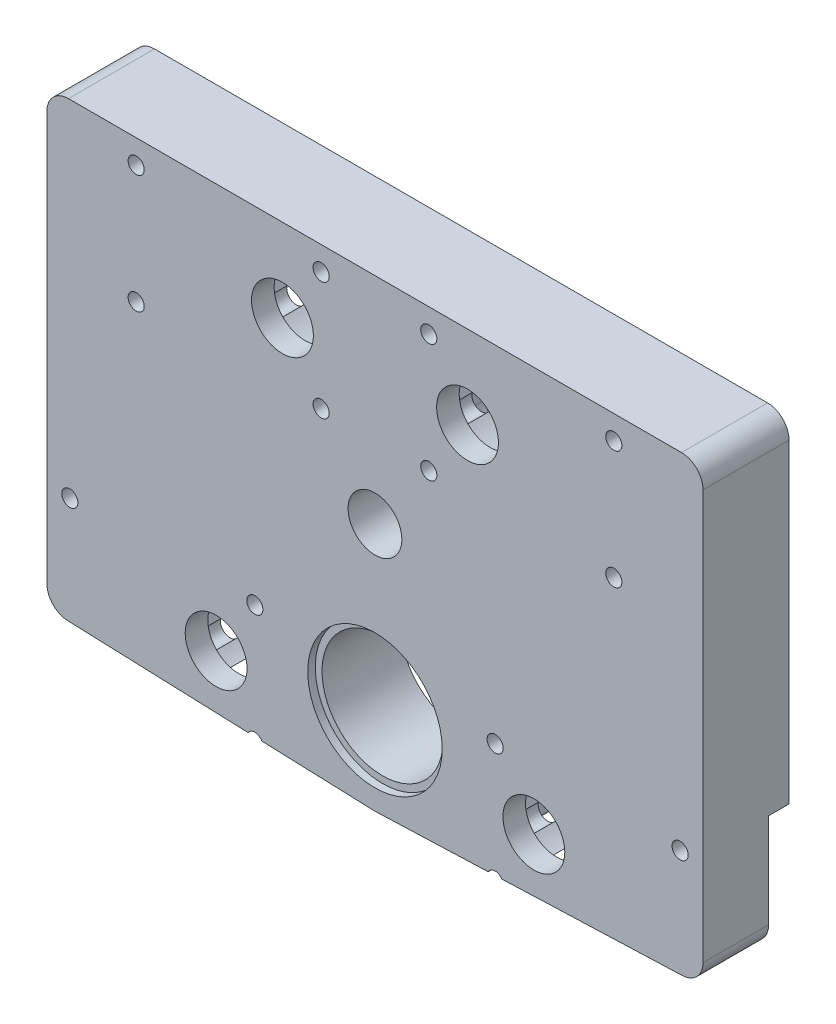
from build123d import *

# Parameters (mm, degrees)
SKETCH1_R             = 7.3025
SKETCH1_R_2           = 6.35
SKETCH1_R_3           = 14.2875
BOSS_EXTRUDE2_DEPTH   = 20.32
CAVITY1_OUTLINE_R     = 7.3025
CAVITY1_OUTLINE_R_2   = 1.143
CAVITY1_OUTLINE_R_3   = 4.445
CAVITY1_DEPTH         = 14.986
CAVITY1_2_OUTLINE_R   = 1.143
CAVITY1_2_OUTLINE_R_2 = 4.445
CAVITY1_2_DEPTH       = 4.826
CAVITY1_START         = 14.986
CAVITY1_3_OUTLINE_R   = 1.143
CAVITY1_3_OUTLINE_R_2 = 4.445
CAVITY1_3_DEPTH       = 3.048
CAVITY1_START_2       = 4.826
CAVITY1_4_DEPTH       = 1.778
CAVITY1_START_3       = 17.018
CAVITY1_5_OUTLINE_R   = 1.905
CAVITY1_5_DEPTH       = 3.302
CAVITY1_6_OUTLINE_R   = 2.286
CAVITY1_6_DEPTH       = 1.27
CAVITY1_START_4       = 18.034
CAVITY1_7_DEPTH       = 0.254
FILLET1_R             = 5.08
SKETCH3_R             = 15.875
CUT_EXTRUDE1_DEPTH    = 1.778


# Read off the part's stored shape, not the designer's step: Cavity1
with BuildPart() as part:
    # Sketch1 → Boss-Extrude2 (new body)
    with BuildSketch(Plane.XY):
        with BuildLine():
            Line((-77.47, 50.8), (77.47, 50.8))
            Line((77.47, 50.8), (77.47, -55.88))
            Line((77.47, -55.88), (0.764469994, -58.7233361))
            ThreePointArc((0.764469994, -58.7233361), (0, -58.7375), (-0.764469994, -58.7233361))
            Line((-0.764469994, -58.7233361), (-77.47, -55.88))
            Line((-77.47, -55.88), (-77.47, 50.8))
        make_face()
        with Locations((-21.853262225, 31.209692887)):
            Circle(SKETCH1_R, mode=Mode.SUBTRACT)
        Circle(SKETCH1_R_2, mode=Mode.SUBTRACT)
        with Locations((-37.52117539, -44.715995569)):
            Circle(SKETCH1_R, mode=Mode.SUBTRACT)
        with Locations((21.853262225, 31.209692887)):
            Circle(SKETCH1_R, mode=Mode.SUBTRACT)
        with Locations((37.52117539, -44.715995569)):
            Circle(SKETCH1_R, mode=Mode.SUBTRACT)
        with Locations((0, -38.1)):
            Circle(SKETCH1_R_3, mode=Mode.SUBTRACT)
    extrude(amount=BOSS_EXTRUDE2_DEPTH)

    # Cavity1 outline → Cavity1 (cut)
    # profile 1 of 22: a face of its own
    with BuildSketch(Plane.XY):
        with BuildLine():
            ThreePointArc((9.143073707, 37.873198634), (7.502262225, 31.209692888), (9.143073707, 24.546187141))
            ThreePointArc((9.143073707, 24.546187141), (7.814157011, 20.972845335), (11.622694721, 21.145564035))
            ThreePointArc((11.622694721, 21.145564035), (21.853262225, 16.858692887), (32.083829729, 21.145564035))
            ThreePointArc((32.083829729, 21.145564035), (35.892367439, 20.972845335), (34.563450743, 24.54618714))
            ThreePointArc((34.563450743, 24.54618714), (36.204262225, 31.209692887), (34.563450743, 37.873198634))
            ThreePointArc((34.563450743, 37.873198634), (35.892367439, 41.446540439), (32.083829729, 41.27382174))
            ThreePointArc((32.083829729, 41.27382174), (21.853262225, 45.560692887), (11.622694721, 41.27382174))
            ThreePointArc((11.622694721, 41.27382174), (7.814157011, 41.446540439), (9.143073707, 37.873198634))
        make_face()
        with Locations((21.853262225, 31.209692887)):
            Circle(CAVITY1_OUTLINE_R, mode=Mode.SUBTRACT)
    # profile 2 of 22: a face of its own
    with BuildSketch(Plane.XY):
        with Locations((12.709262225, 45.179692887)):
            Circle(CAVITY1_OUTLINE_R_2)
    # profile 3 of 22: a face of its own
    with BuildSketch(Plane.XY):
        with BuildLine():
            ThreePointArc((-11.622694721, 41.27382174), (-21.853262225, 45.560692887), (-32.083829729, 41.27382174))
            ThreePointArc((-32.083829729, 41.27382174), (-35.892367439, 41.446540439), (-34.563450743, 37.873198634))
            ThreePointArc((-34.563450743, 37.873198634), (-36.204262225, 31.209692887), (-34.563450743, 24.546187141))
            ThreePointArc((-34.563450743, 24.546187141), (-35.892367439, 20.972845335), (-32.083829729, 21.145564035))
            ThreePointArc((-32.083829729, 21.145564035), (-21.853262225, 16.858692887), (-11.622694721, 21.145564035))
            ThreePointArc((-11.622694721, 21.145564035), (-7.814157011, 20.972845335), (-9.143073707, 24.54618714))
            ThreePointArc((-9.143073707, 24.54618714), (-7.502262225, 31.209692887), (-9.143073707, 37.873198634))
            ThreePointArc((-9.143073707, 37.873198634), (-7.814157011, 41.446540439), (-11.622694721, 41.27382174))
        make_face()
        with Locations((-21.853262225, 31.209692887)):
            Circle(CAVITY1_OUTLINE_R, mode=Mode.SUBTRACT)
    # profile 4 of 22: a face of its own
    with BuildSketch(Plane.XY):
        with Locations((56.397262225, 45.179692887)):
            Circle(CAVITY1_OUTLINE_R_2)
    # profile 5 of 22: a face of its own
    with BuildSketch(Plane.XY):
        with Locations((-12.709262225, 45.179692887)):
            Circle(CAVITY1_OUTLINE_R_2)
    # profile 6 of 22: a face of its own
    with BuildSketch(Plane.XY):
        with Locations((47.253262225, 31.209692887)):
            Circle(CAVITY1_OUTLINE_R_3)
    # profile 7 of 22: a face of its own
    with BuildSketch(Plane.XY):
        with Locations((12.709262225, 17.239692887)):
            Circle(CAVITY1_OUTLINE_R_2)
    # profile 8 of 22: a face of its own
    with BuildSketch(Plane.XY):
        with Locations((-56.397262225, 45.179692887)):
            Circle(CAVITY1_OUTLINE_R_2)
    # profile 9 of 22: a face of its own
    with BuildSketch(Plane.XY):
        with Locations((-12.709262225, 17.239692887)):
            Circle(CAVITY1_OUTLINE_R_2)
    # profile 10 of 22: a face of its own
    with BuildSketch(Plane.XY):
        with Locations((-47.253262225, 31.209692887)):
            Circle(CAVITY1_OUTLINE_R_3)
    # profile 11 of 22: a face of its own
    with BuildSketch(Plane.XY):
        with Locations((56.397262225, 17.239692887)):
            Circle(CAVITY1_OUTLINE_R_2)
    # profile 12 of 22: a face of its own
    with BuildSketch(Plane.XY):
        with BuildLine():
            ThreePointArc((44.787432071, -57.091484038), (46.345590949, -56.033278416), (47.751742893, -54.780124421))
            ThreePointArc((47.751742893, -54.780124421), (51.560280604, -54.952843121), (50.231363908, -51.379501316))
            ThreePointArc((50.231363908, -51.379501316), (51.87217539, -44.715995569), (50.231363908, -38.052489822))
            ThreePointArc((50.231363908, -38.052489822), (51.560280604, -34.479148017), (47.751742893, -34.651866717))
            ThreePointArc((47.751742893, -34.651866717), (37.52117539, -30.364995569), (27.290607886, -34.651866717))
            ThreePointArc((27.290607886, -34.651866717), (23.482070176, -34.479148017), (24.810986872, -38.052489822))
            ThreePointArc((24.810986872, -38.052489822), (23.17017539, -44.715995569), (24.810986872, -51.379501316))
            ThreePointArc((24.810986872, -51.379501316), (23.482070176, -54.952843121), (27.290607886, -54.780124421))
            ThreePointArc((27.290607886, -54.780124421), (29.122039602, -56.352391877), (31.191075024, -57.595476551))
            Line((31.191075024, -57.595476551), (44.787432071, -57.091484038))
        make_face()
        with Locations((37.52117539, -44.715995569)):
            Circle(CAVITY1_OUTLINE_R, mode=Mode.SUBTRACT)
    # profile 13 of 22: a face of its own
    with BuildSketch(Plane.XY):
        with Locations((28.37717539, -30.745995569)):
            Circle(CAVITY1_OUTLINE_R_2)
    # profile 14 of 22: a face of its own
    with BuildSketch(Plane.XY):
        with BuildLine():
            ThreePointArc((-50.231363908, -51.379501316), (-51.560280604, -54.952843121), (-47.751742893, -54.780124421))
            ThreePointArc((-47.751742893, -54.780124421), (-46.345590949, -56.033278416), (-44.787432071, -57.091484038))
            Line((-44.787432071, -57.091484038), (-31.191075024, -57.595476551))
            ThreePointArc((-31.191075024, -57.595476551), (-29.122039602, -56.352391877), (-27.290607886, -54.780124421))
            ThreePointArc((-27.290607886, -54.780124421), (-23.482070176, -54.952843121), (-24.810986872, -51.379501316))
            ThreePointArc((-24.810986872, -51.379501316), (-23.17017539, -44.715995569), (-24.810986872, -38.052489822))
            ThreePointArc((-24.810986872, -38.052489822), (-23.482070176, -34.479148017), (-27.290607886, -34.651866717))
            ThreePointArc((-27.290607886, -34.651866717), (-37.52117539, -30.364995569), (-47.751742893, -34.651866717))
            ThreePointArc((-47.751742893, -34.651866717), (-51.560280604, -34.479148017), (-50.231363908, -38.052489822))
            ThreePointArc((-50.231363908, -38.052489822), (-51.87217539, -44.715995569), (-50.231363908, -51.379501316))
        make_face()
        with Locations((-37.52117539, -44.715995569)):
            Circle(CAVITY1_OUTLINE_R, mode=Mode.SUBTRACT)
    # profile 15 of 22: a face of its own
    with BuildSketch(Plane.XY):
        with Locations((-56.397262225, 17.239692887)):
            Circle(CAVITY1_OUTLINE_R_2)
    # profile 16 of 22: a face of its own
    with BuildSketch(Plane.XY):
        with Locations((72.06517539, -30.745995569)):
            Circle(CAVITY1_OUTLINE_R_2)
    # profile 17 of 22: a face of its own
    with BuildSketch(Plane.XY):
        with Locations((-28.37717539, -30.745995569)):
            Circle(CAVITY1_OUTLINE_R_2)
    # profile 18 of 22: a face of its own
    with BuildSketch(Plane.XY):
        with Locations((-72.06517539, -30.745995569)):
            Circle(CAVITY1_OUTLINE_R_2)
    # profile 19 of 22: a face of its own
    with BuildSketch(Plane.XY):
        with Locations((62.92117539, -44.715995569)):
            Circle(CAVITY1_OUTLINE_R_3)
    # profile 20 of 22: a face of its own
    with BuildSketch(Plane.XY):
        with BuildLine():
            ThreePointArc((-27.762128908, -57.722581419), (-28.334835513, -57.543780031), (-28.919207924, -57.67969058))
            Line((-28.919207924, -57.67969058), (-27.762128908, -57.722581419))
        make_face()
    # profile 21 of 22: a face of its own
    with BuildSketch(Plane.XY):
        with BuildLine():
            Line((27.762128908, -57.722581419), (28.919207924, -57.67969058))
            ThreePointArc((28.919207924, -57.67969058), (28.334835513, -57.543780031), (27.762128908, -57.722581419))
        make_face()
    # profile 22 of 22: a face of its own
    with BuildSketch(Plane.XY):
        with Locations((-62.92117539, -44.715995569)):
            Circle(CAVITY1_OUTLINE_R_3)
    extrude(amount=CAVITY1_DEPTH, mode=Mode.SUBTRACT)

    # Cavity1 2 outline → Cavity1 2 (cut)
    # profile 1 of 4: a face of its own
    with BuildSketch(Plane.XY):
        with BuildLine():
            ThreePointArc((9.280262225, 47.846692887), (6.765790511, 46.805164601), (5.724262225, 44.290692887))
            Line((5.724262225, 44.290692887), (5.724262225, 18.128692887))
            ThreePointArc((5.724262225, 18.128692887), (6.765790512, 15.614221174), (9.280262225, 14.572692887))
            Line((9.280262225, 14.572692887), (59.826262225, 14.572692887))
            ThreePointArc((59.826262225, 14.572692887), (62.340733939, 15.614221173), (63.382262225, 18.128692887))
            Line((63.382262225, 18.128692887), (63.382262225, 44.290692887))
            ThreePointArc((63.382262225, 44.290692887), (62.340733939, 46.805164601), (59.826262225, 47.846692887))
            Line((59.826262225, 47.846692887), (9.280262225, 47.846692887))
        make_face()
        with BuildLine():
            ThreePointArc((11.622694721, 41.27382174), (21.853262225, 45.560692887), (32.083829729, 41.27382174))
            ThreePointArc((32.083829729, 41.27382174), (35.892367439, 41.446540439), (34.563450743, 37.873198634))
            ThreePointArc((34.563450743, 37.873198634), (36.204262225, 31.209692887), (34.563450743, 24.546187141))
            ThreePointArc((34.563450743, 24.546187141), (35.892367439, 20.972845335), (32.083829729, 21.145564035))
            ThreePointArc((32.083829729, 21.145564035), (21.853262225, 16.858692887), (11.622694721, 21.145564035))
            ThreePointArc((11.622694721, 21.145564035), (7.814157011, 20.972845335), (9.143073707, 24.54618714))
            ThreePointArc((9.143073707, 24.54618714), (7.502262225, 31.209692888), (9.143073707, 37.873198634))
            ThreePointArc((9.143073707, 37.873198634), (7.814157011, 41.446540439), (11.622694721, 41.27382174))
        make_face(mode=Mode.SUBTRACT)
        with Locations((12.709262225, 45.179692887)):
            Circle(CAVITY1_2_OUTLINE_R, mode=Mode.SUBTRACT)
        with Locations((56.397262225, 45.179692887)):
            Circle(CAVITY1_2_OUTLINE_R, mode=Mode.SUBTRACT)
        with Locations((47.253262225, 31.209692887)):
            Circle(CAVITY1_2_OUTLINE_R_2, mode=Mode.SUBTRACT)
        with Locations((12.709262225, 17.239692887)):
            Circle(CAVITY1_2_OUTLINE_R, mode=Mode.SUBTRACT)
        with Locations((56.397262225, 17.239692887)):
            Circle(CAVITY1_2_OUTLINE_R, mode=Mode.SUBTRACT)
    # profile 2 of 4: a face of its own
    with BuildSketch(Plane.XY):
        with BuildLine():
            Line((-9.280262225, 47.846692887), (-59.826262225, 47.846692887))
            ThreePointArc((-59.826262225, 47.846692887), (-62.340733939, 46.805164601), (-63.382262225, 44.290692887))
            Line((-63.382262225, 44.290692887), (-63.382262225, 18.128692887))
            ThreePointArc((-63.382262225, 18.128692887), (-62.340733939, 15.614221173), (-59.826262225, 14.572692887))
            Line((-59.826262225, 14.572692887), (-9.280262225, 14.572692887))
            ThreePointArc((-9.280262225, 14.572692887), (-6.765790512, 15.614221174), (-5.724262225, 18.128692887))
            Line((-5.724262225, 18.128692887), (-5.724262225, 44.290692887))
            ThreePointArc((-5.724262225, 44.290692887), (-6.765790511, 46.805164601), (-9.280262225, 47.846692887))
        make_face()
        with BuildLine():
            ThreePointArc((-9.143073707, 37.873198634), (-7.502262225, 31.209692887), (-9.143073707, 24.546187141))
            ThreePointArc((-9.143073707, 24.546187141), (-7.814157011, 20.972845335), (-11.622694721, 21.145564035))
            ThreePointArc((-11.622694721, 21.145564035), (-21.853262225, 16.858692887), (-32.083829729, 21.145564035))
            ThreePointArc((-32.083829729, 21.145564035), (-35.892367439, 20.972845335), (-34.563450743, 24.54618714))
            ThreePointArc((-34.563450743, 24.54618714), (-36.204262225, 31.209692887), (-34.563450743, 37.873198634))
            ThreePointArc((-34.563450743, 37.873198634), (-35.892367439, 41.446540439), (-32.083829729, 41.27382174))
            ThreePointArc((-32.083829729, 41.27382174), (-21.853262225, 45.560692887), (-11.622694721, 41.27382174))
            ThreePointArc((-11.622694721, 41.27382174), (-7.814157011, 41.446540439), (-9.143073707, 37.873198634))
        make_face(mode=Mode.SUBTRACT)
        with Locations((-12.709262225, 45.179692887)):
            Circle(CAVITY1_2_OUTLINE_R, mode=Mode.SUBTRACT)
        with Locations((-47.253262225, 31.209692887)):
            Circle(CAVITY1_2_OUTLINE_R_2, mode=Mode.SUBTRACT)
        with Locations((-56.397262225, 45.179692887)):
            Circle(CAVITY1_2_OUTLINE_R, mode=Mode.SUBTRACT)
        with Locations((-12.709262225, 17.239692887)):
            Circle(CAVITY1_2_OUTLINE_R, mode=Mode.SUBTRACT)
        with Locations((-56.397262225, 17.239692887)):
            Circle(CAVITY1_2_OUTLINE_R, mode=Mode.SUBTRACT)
    # profile 3 of 4: a face of its own
    with BuildSketch(Plane.XY):
        with BuildLine():
            ThreePointArc((27.290607886, -34.651866717), (37.52117539, -30.364995569), (47.751742893, -34.651866717))
            ThreePointArc((47.751742893, -34.651866717), (51.560280604, -34.479148017), (50.231363908, -38.052489822))
            ThreePointArc((50.231363908, -38.052489822), (51.87217539, -44.715995569), (50.231363908, -51.379501316))
            ThreePointArc((50.231363908, -51.379501316), (51.560280604, -54.952843121), (47.751742893, -54.780124421))
            ThreePointArc((47.751742893, -54.780124421), (46.345590949, -56.033278416), (44.787432071, -57.091484038))
            Line((44.787432071, -57.091484038), (77.47, -55.88))
            Line((77.47, -55.88), (77.47, -28.678434542))
            ThreePointArc((77.47, -28.678434542), (76.526552498, -28.232153594), (75.49417539, -28.078995569))
            Line((75.49417539, -28.078995569), (24.94817539, -28.078995569))
            ThreePointArc((24.94817539, -28.078995569), (22.433703676, -29.120523855), (21.39217539, -31.634995569))
            Line((21.39217539, -31.634995569), (21.39217539, -57.796995569))
            ThreePointArc((21.39217539, -57.796995569), (21.393093645, -57.877802656), (21.395847935, -57.95856801))
            Line((21.395847935, -57.95856801), (27.762128908, -57.722581419))
            ThreePointArc((27.762128908, -57.722581419), (28.334835513, -57.543780031), (28.919207924, -57.67969058))
            Line((28.919207924, -57.67969058), (31.191075024, -57.595476551))
            ThreePointArc((31.191075024, -57.595476551), (29.122039602, -56.352391877), (27.290607886, -54.780124421))
            ThreePointArc((27.290607886, -54.780124421), (23.482070176, -54.952843121), (24.810986872, -51.379501316))
            ThreePointArc((24.810986872, -51.379501316), (23.17017539, -44.715995569), (24.810986872, -38.052489822))
            ThreePointArc((24.810986872, -38.052489822), (23.482070176, -34.479148017), (27.290607886, -34.651866717))
        make_face()
        with Locations((28.37717539, -30.745995569)):
            Circle(CAVITY1_2_OUTLINE_R, mode=Mode.SUBTRACT)
        with Locations((62.92117539, -44.715995569)):
            Circle(CAVITY1_2_OUTLINE_R_2, mode=Mode.SUBTRACT)
        with Locations((72.06517539, -30.745995569)):
            Circle(CAVITY1_2_OUTLINE_R, mode=Mode.SUBTRACT)
    # profile 4 of 4: a face of its own
    with BuildSketch(Plane.XY):
        with BuildLine():
            ThreePointArc((-27.290607886, -34.651866717), (-23.482070176, -34.479148017), (-24.810986872, -38.052489822))
            ThreePointArc((-24.810986872, -38.052489822), (-23.17017539, -44.715995569), (-24.810986872, -51.379501316))
            ThreePointArc((-24.810986872, -51.379501316), (-23.482070176, -54.952843121), (-27.290607886, -54.780124421))
            ThreePointArc((-27.290607886, -54.780124421), (-29.122039602, -56.352391877), (-31.191075024, -57.595476551))
            Line((-31.191075024, -57.595476551), (-28.919207924, -57.67969058))
            ThreePointArc((-28.919207924, -57.67969058), (-28.334835513, -57.543780031), (-27.762128908, -57.722581419))
            Line((-27.762128908, -57.722581419), (-21.395847935, -57.95856801))
            ThreePointArc((-21.395847935, -57.95856801), (-21.393093645, -57.877802656), (-21.39217539, -57.796995569))
            Line((-21.39217539, -57.796995569), (-21.39217539, -31.634995569))
            ThreePointArc((-21.39217539, -31.634995569), (-22.433703676, -29.120523855), (-24.94817539, -28.078995569))
            Line((-24.94817539, -28.078995569), (-75.49417539, -28.078995569))
            ThreePointArc((-75.49417539, -28.078995569), (-76.526552498, -28.232153594), (-77.47, -28.678434542))
            Line((-77.47, -28.678434542), (-77.47, -55.88))
            Line((-77.47, -55.88), (-44.787432071, -57.091484038))
            ThreePointArc((-44.787432071, -57.091484038), (-46.345590949, -56.033278416), (-47.751742893, -54.780124421))
            ThreePointArc((-47.751742893, -54.780124421), (-51.560280604, -54.952843121), (-50.231363908, -51.379501316))
            ThreePointArc((-50.231363908, -51.379501316), (-51.87217539, -44.715995569), (-50.231363908, -38.052489822))
            ThreePointArc((-50.231363908, -38.052489822), (-51.560280604, -34.479148017), (-47.751742893, -34.651866717))
            ThreePointArc((-47.751742893, -34.651866717), (-37.52117539, -30.364995569), (-27.290607886, -34.651866717))
        make_face()
        with Locations((-28.37717539, -30.745995569)):
            Circle(CAVITY1_2_OUTLINE_R, mode=Mode.SUBTRACT)
        with Locations((-62.92117539, -44.715995569)):
            Circle(CAVITY1_2_OUTLINE_R_2, mode=Mode.SUBTRACT)
        with Locations((-72.06517539, -30.745995569)):
            Circle(CAVITY1_2_OUTLINE_R, mode=Mode.SUBTRACT)
    extrude(amount=CAVITY1_2_DEPTH, mode=Mode.SUBTRACT)

    # Cavity1 3 outline → Cavity1 3 (cut)
    with BuildSketch(Plane.XY.offset(CAVITY1_START)):
        with Locations((12.709262225, 45.179692887)):
            Circle(CAVITY1_3_OUTLINE_R)
        with Locations((56.397262225, 45.179692887)):
            Circle(CAVITY1_3_OUTLINE_R)
        with BuildLine():
            ThreePointArc((35.740077225, 27.589255047), (36.204262225, 31.209692887), (35.740077225, 34.830130728))
            ThreePointArc((35.740077225, 34.830130728), (30.743262225, 31.209692888), (35.740077225, 27.589255047))
        make_face()
        with Locations((-12.709262225, 45.179692887)):
            Circle(CAVITY1_3_OUTLINE_R)
        with Locations((47.253262225, 31.209692887)):
            Circle(CAVITY1_3_OUTLINE_R_2)
        with Locations((12.709262225, 17.239692887)):
            Circle(CAVITY1_3_OUTLINE_R)
        with Locations((-56.397262225, 45.179692887)):
            Circle(CAVITY1_3_OUTLINE_R)
        with Locations((-12.709262225, 17.239692887)):
            Circle(CAVITY1_3_OUTLINE_R)
        with BuildLine():
            ThreePointArc((-35.740077225, 27.589255047), (-30.743262225, 31.209692888), (-35.740077225, 34.830130728))
            ThreePointArc((-35.740077225, 34.830130728), (-36.204262225, 31.209692888), (-35.740077225, 27.589255047))
        make_face()
        with Locations((-47.253262225, 31.209692887)):
            Circle(CAVITY1_3_OUTLINE_R_2)
        with Locations((56.397262225, 17.239692887)):
            Circle(CAVITY1_3_OUTLINE_R)
        with Locations((28.37717539, -30.745995569)):
            Circle(CAVITY1_3_OUTLINE_R)
        with Locations((-56.397262225, 17.239692887)):
            Circle(CAVITY1_3_OUTLINE_R)
        with Locations((72.06517539, -30.745995569)):
            Circle(CAVITY1_3_OUTLINE_R)
        with Locations((-28.37717539, -30.745995569)):
            Circle(CAVITY1_3_OUTLINE_R)
        with BuildLine():
            ThreePointArc((51.40799039, -48.336433409), (51.87217539, -44.715995569), (51.40799039, -41.095557729))
            ThreePointArc((51.40799039, -41.095557729), (46.41117539, -44.715995569), (51.40799039, -48.336433409))
        make_face()
        with Locations((-72.06517539, -30.745995569)):
            Circle(CAVITY1_3_OUTLINE_R)
        with Locations((62.92117539, -44.715995569)):
            Circle(CAVITY1_3_OUTLINE_R_2)
        with BuildLine():
            ThreePointArc((-27.762128908, -57.722581419), (-28.334835513, -57.543780031), (-28.919207924, -57.67969058))
            Line((-28.919207924, -57.67969058), (-27.762128908, -57.722581419))
        make_face()
        with BuildLine():
            Line((27.762128908, -57.722581419), (28.919207924, -57.67969058))
            ThreePointArc((28.919207924, -57.67969058), (28.334835513, -57.543780031), (27.762128908, -57.722581419))
        make_face()
        with Locations((-62.92117539, -44.715995569)):
            Circle(CAVITY1_3_OUTLINE_R_2)
        with BuildLine():
            ThreePointArc((-51.40799039, -48.336433409), (-46.41117539, -44.715995569), (-51.40799039, -41.095557729))
            ThreePointArc((-51.40799039, -41.095557729), (-51.87217539, -44.715995569), (-51.40799039, -48.336433409))
        make_face()
    extrude(amount=CAVITY1_3_DEPTH, mode=Mode.SUBTRACT)

    # Cavity1 4 outline → Cavity1 4 (cut)
    with BuildSketch(Plane.XY.offset(CAVITY1_START_2)):
        with BuildLine():
            Line((46.242320893, 35.538205636), (48.151988191, 37.47945465))
            ThreePointArc((48.151988191, 37.47945465), (44.760929015, 35.790736507), (42.934910561, 32.47159386))
            Line((42.934910561, 32.47159386), (42.986204133, 32.454779325))
            ThreePointArc((42.986204133, 32.454779325), (44.196924721, 34.437203702), (46.242320893, 35.538205636))
        make_face()
        with BuildLine():
            ThreePointArc((54.920931867, 33.876927147), (52.141612003, 36.815236937), (48.151988191, 37.47945465))
            Line((48.151988191, 37.47945465), (46.242320893, 35.538205636))
            ThreePointArc((46.242320893, 35.538205636), (49.368142826, 35.119335459), (51.429331168, 32.732346225))
            Line((51.429331168, 32.732346225), (54.920931867, 33.876927147))
        make_face()
        with BuildLine():
            ThreePointArc((55.508262225, 31.209692887), (55.359691585, 32.575260127), (54.920931867, 33.876927147))
            Line((54.920931867, 33.876927147), (51.429331168, 32.732346225))
            ThreePointArc((51.429331168, 32.732346225), (51.630513157, 31.982803018), (51.698262225, 31.209692887))
            ThreePointArc((51.698262225, 31.209692887), (51.630513157, 30.436582756), (51.429331168, 29.68703955))
            Line((51.429331168, 29.68703955), (54.736042469, 28.603067184))
            Line((54.736042469, 28.603067184), (55.102132402, 28.975211443))
            ThreePointArc((55.102132402, 28.975211443), (55.405904805, 30.074148001), (55.508262225, 31.209692887))
        make_face()
        with BuildLine():
            Line((42.986204133, 32.454779325), (42.934910561, 32.47159386))
            ThreePointArc((42.934910561, 32.47159386), (42.901305735, 32.292742046), (42.872839807, 32.113000713))
            Line((42.872839807, 32.113000713), (42.908751161, 32.149505962))
            ThreePointArc((42.908751161, 32.149505962), (42.944773071, 32.302828839), (42.986204133, 32.454779325))
        make_face()
        with BuildLine():
            ThreePointArc((54.920931867, 28.542458628), (55.015530136, 28.757161008), (55.102132402, 28.975211443))
            Line((55.102132402, 28.975211443), (54.736042469, 28.603067184))
            Line((54.736042469, 28.603067184), (54.920931867, 28.542458628))
        make_face()
        with BuildLine():
            Line((42.908751161, 32.149505962), (42.872839807, 32.113000713))
            ThreePointArc((42.872839807, 32.113000713), (42.824427196, 31.662499494), (42.808262225, 31.209692887))
            ThreePointArc((42.808262225, 31.209692887), (42.833455856, 31.68227797), (42.908751161, 32.149505962))
        make_face()
        with BuildLine():
            Line((42.90875116, 30.269879818), (42.872839806, 30.306385067))
            ThreePointArc((42.872839806, 30.306385067), (42.901305734, 30.126643731), (42.934910561, 29.947791915))
            Line((42.934910561, 29.947791915), (42.986204132, 29.96460645))
            ThreePointArc((42.986204132, 29.96460645), (42.94477307, 30.116556938), (42.90875116, 30.269879818))
        make_face()
        with BuildLine():
            ThreePointArc((42.808262225, 31.209692887), (42.824427196, 30.756886283), (42.872839806, 30.306385067))
            Line((42.872839806, 30.306385067), (42.90875116, 30.269879818))
            ThreePointArc((42.90875116, 30.269879818), (42.833455856, 30.737107807), (42.808262225, 31.209692887))
        make_face()
        with BuildLine():
            ThreePointArc((51.489929006, 25.30327011), (53.517465833, 26.592351238), (54.920931867, 28.542458628))
            Line((54.920931867, 28.542458628), (54.736042469, 28.603067184))
            Line((54.736042469, 28.603067184), (51.489929006, 25.30327011))
        make_face()
        with BuildLine():
            Line((51.489929006, 25.30327011), (54.736042469, 28.603067184))
            Line((54.736042469, 28.603067184), (51.429331168, 29.68703955))
            ThreePointArc((51.429331168, 29.68703955), (49.36814283, 27.300050317), (46.2423209, 26.881180136))
            Line((46.2423209, 26.881180136), (48.151988199, 24.939931122))
            ThreePointArc((48.151988199, 24.939931122), (49.845408711, 24.896981132), (51.489929006, 25.30327011))
        make_face()
        with BuildLine():
            Line((42.986204132, 29.96460645), (42.934910561, 29.947791915))
            ThreePointArc((42.934910561, 29.947791915), (44.760929018, 26.628649265), (48.151988199, 24.939931122))
            Line((48.151988199, 24.939931122), (46.2423209, 26.881180136))
            ThreePointArc((46.2423209, 26.881180136), (44.196924724, 27.982182069), (42.986204132, 29.96460645))
        make_face()
        with BuildLine():
            Line((-46.242320893, 35.538205636), (-48.151988191, 37.47945465))
            ThreePointArc((-48.151988191, 37.47945465), (-52.141612003, 36.815236937), (-54.920931867, 33.876927147))
            Line((-54.920931867, 33.876927147), (-51.429331168, 32.732346225))
            ThreePointArc((-51.429331168, 32.732346225), (-49.368142826, 35.119335459), (-46.242320893, 35.538205636))
        make_face()
        with BuildLine():
            ThreePointArc((-42.934910561, 32.47159386), (-44.760929015, 35.790736507), (-48.151988191, 37.47945465))
            Line((-48.151988191, 37.47945465), (-46.242320893, 35.538205636))
            ThreePointArc((-46.242320893, 35.538205636), (-44.196924721, 34.437203702), (-42.986204133, 32.454779325))
            Line((-42.986204133, 32.454779325), (-42.934910561, 32.47159386))
        make_face()
        with BuildLine():
            ThreePointArc((-42.872839807, 32.113000713), (-42.901305735, 32.292742046), (-42.934910561, 32.47159386))
            Line((-42.934910561, 32.47159386), (-42.986204133, 32.454779325))
            ThreePointArc((-42.986204133, 32.454779325), (-42.944773071, 32.302828839), (-42.908751161, 32.149505962))
            Line((-42.908751161, 32.149505962), (-42.872839807, 32.113000713))
        make_face()
        with BuildLine():
            Line((-51.429331168, 32.732346225), (-54.920931867, 33.876927147))
            ThreePointArc((-54.920931867, 33.876927147), (-55.503927899, 31.44427157), (-55.102132402, 28.975211443))
            Line((-55.102132402, 28.975211443), (-54.736042469, 28.603067184))
            Line((-54.736042469, 28.603067184), (-51.429331168, 29.68703955))
            ThreePointArc((-51.429331168, 29.68703955), (-51.698262225, 31.209692887), (-51.429331168, 32.732346225))
        make_face()
        with BuildLine():
            ThreePointArc((-42.808262225, 31.209692887), (-42.824427196, 31.662499494), (-42.872839807, 32.113000713))
            Line((-42.872839807, 32.113000713), (-42.908751161, 32.149505962))
            ThreePointArc((-42.908751161, 32.149505962), (-42.833455856, 31.68227797), (-42.808262225, 31.209692887))
        make_face()
        with BuildLine():
            Line((-42.90875116, 30.269879818), (-42.872839806, 30.306385067))
            ThreePointArc((-42.872839806, 30.306385067), (-42.824427196, 30.756886283), (-42.808262225, 31.209692887))
            ThreePointArc((-42.808262225, 31.209692887), (-42.833455856, 30.737107807), (-42.90875116, 30.269879818))
        make_face()
        with BuildLine():
            ThreePointArc((-42.934910561, 29.947791915), (-42.901305734, 30.126643731), (-42.872839806, 30.306385067))
            Line((-42.872839806, 30.306385067), (-42.90875116, 30.269879818))
            ThreePointArc((-42.90875116, 30.269879818), (-42.94477307, 30.116556938), (-42.986204132, 29.96460645))
            Line((-42.986204132, 29.96460645), (-42.934910561, 29.947791915))
        make_face()
        with BuildLine():
            Line((-54.736042469, 28.603067184), (-55.102132402, 28.975211443))
            ThreePointArc((-55.102132402, 28.975211443), (-55.015530136, 28.757161008), (-54.920931867, 28.542458628))
            Line((-54.920931867, 28.542458628), (-54.736042469, 28.603067184))
        make_face()
        with BuildLine():
            ThreePointArc((-48.151988199, 24.939931122), (-44.760929018, 26.628649265), (-42.934910561, 29.947791915))
            Line((-42.934910561, 29.947791915), (-42.986204132, 29.96460645))
            ThreePointArc((-42.986204132, 29.96460645), (-44.196924724, 27.982182069), (-46.2423209, 26.881180136))
            Line((-46.2423209, 26.881180136), (-48.151988199, 24.939931122))
        make_face()
        with BuildLine():
            Line((-54.736042469, 28.603067184), (-54.920931867, 28.542458628))
            ThreePointArc((-54.920931867, 28.542458628), (-53.517465833, 26.592351238), (-51.489929006, 25.30327011))
            Line((-51.489929006, 25.30327011), (-54.736042469, 28.603067184))
        make_face()
        with BuildLine():
            Line((-51.429331168, 29.68703955), (-54.736042469, 28.603067184))
            Line((-54.736042469, 28.603067184), (-51.489929006, 25.30327011))
            ThreePointArc((-51.489929006, 25.30327011), (-49.845408711, 24.896981132), (-48.151988199, 24.939931122))
            Line((-48.151988199, 24.939931122), (-46.2423209, 26.881180136))
            ThreePointArc((-46.2423209, 26.881180136), (-49.36814283, 27.300050317), (-51.429331168, 29.68703955))
        make_face()
        with BuildLine():
            Line((70.403955716, -42.109369836), (70.588845031, -42.048761307))
            ThreePointArc((70.588845031, -42.048761307), (69.185379065, -40.098653984), (67.157842346, -38.809572861))
            Line((67.157842346, -38.809572861), (70.403955716, -42.109369836))
        make_face()
        with BuildLine():
            ThreePointArc((70.770045497, -42.48151394), (70.683443262, -42.263463598), (70.588845031, -42.048761307))
            Line((70.588845031, -42.048761307), (70.403955716, -42.109369836))
            Line((70.403955716, -42.109369836), (70.770045497, -42.48151394))
        make_face()
        with BuildLine():
            Line((61.910234044, -40.387482823), (63.819901343, -38.446233808))
            ThreePointArc((63.819901343, -38.446233808), (60.428842175, -40.134951955), (58.602823726, -43.454094598))
            Line((58.602823726, -43.454094598), (58.654117297, -43.470909133))
            ThreePointArc((58.654117297, -43.470909133), (59.864837881, -41.488484759), (61.910234044, -40.387482823))
        make_face()
        with BuildLine():
            ThreePointArc((67.157842346, -38.809572861), (65.513321959, -38.403283823), (63.819901343, -38.446233808))
            Line((63.819901343, -38.446233808), (61.910234044, -40.387482823))
            ThreePointArc((61.910234044, -40.387482823), (65.036055984, -40.806352993), (67.097244332, -43.19334223))
            Line((67.097244332, -43.19334223), (70.403955716, -42.109369836))
            Line((70.403955716, -42.109369836), (67.157842346, -38.809572861))
        make_face()
        with BuildLine():
            ThreePointArc((71.17617539, -44.715995569), (71.073817953, -43.580450586), (70.770045497, -42.48151394))
            Line((70.770045497, -42.48151394), (70.403955716, -42.109369836))
            Line((70.403955716, -42.109369836), (67.097244332, -43.19334223))
            ThreePointArc((67.097244332, -43.19334223), (67.298426322, -43.942885437), (67.36617539, -44.715995569))
            ThreePointArc((67.36617539, -44.715995569), (67.298426322, -45.489105701), (67.097244332, -46.238648908))
            Line((67.097244332, -46.238648908), (70.588845031, -47.383229831))
            ThreePointArc((70.588845031, -47.383229831), (71.02760475, -46.08156281), (71.17617539, -44.715995569))
        make_face()
        with BuildLine():
            Line((-70.403955716, -42.109369836), (-70.588845031, -42.048761307))
            ThreePointArc((-70.588845031, -42.048761307), (-70.683443262, -42.263463598), (-70.770045497, -42.48151394))
            Line((-70.770045497, -42.48151394), (-70.403955716, -42.109369836))
        make_face()
        with BuildLine():
            ThreePointArc((-67.157842346, -38.809572861), (-69.185379065, -40.098653984), (-70.588845031, -42.048761307))
            Line((-70.588845031, -42.048761307), (-70.403955716, -42.109369836))
            Line((-70.403955716, -42.109369836), (-67.157842346, -38.809572861))
        make_face()
        with BuildLine():
            Line((58.654117297, -43.470909133), (58.602823726, -43.454094598))
            ThreePointArc((58.602823726, -43.454094598), (58.5692189, -43.632946406), (58.540752973, -43.812687734))
            Line((58.540752973, -43.812687734), (58.576664328, -43.776182484))
            ThreePointArc((58.576664328, -43.776182484), (58.612686237, -43.622859612), (58.654117297, -43.470909133))
        make_face()
        with BuildLine():
            ThreePointArc((63.819901354, -50.985757332), (67.809525166, -50.321539621), (70.588845031, -47.383229831))
            Line((70.588845031, -47.383229831), (67.097244332, -46.238648908))
            ThreePointArc((67.097244332, -46.238648908), (65.036055989, -48.625638142), (61.910234055, -49.044508318))
            Line((61.910234055, -49.044508318), (63.819901354, -50.985757332))
        make_face()
        with BuildLine():
            ThreePointArc((-63.819901343, -38.446233808), (-65.513321959, -38.403283823), (-67.157842346, -38.809572861))
            Line((-67.157842346, -38.809572861), (-70.403955716, -42.109369836))
            Line((-70.403955716, -42.109369836), (-67.097244332, -43.19334223))
            ThreePointArc((-67.097244332, -43.19334223), (-65.036055984, -40.806352993), (-61.910234044, -40.387482823))
            Line((-61.910234044, -40.387482823), (-63.819901343, -38.446233808))
        make_face()
        with BuildLine():
            ThreePointArc((-58.602823726, -43.454094598), (-60.428842175, -40.134951955), (-63.819901343, -38.446233808))
            Line((-63.819901343, -38.446233808), (-61.910234044, -40.387482823))
            ThreePointArc((-61.910234044, -40.387482823), (-59.864837881, -41.488484759), (-58.654117297, -43.470909133))
            Line((-58.654117297, -43.470909133), (-58.602823726, -43.454094598))
        make_face()
        with BuildLine():
            Line((-70.403955716, -42.109369836), (-70.770045497, -42.48151394))
            ThreePointArc((-70.770045497, -42.48151394), (-71.171841067, -44.950574154), (-70.588845031, -47.383229831))
            Line((-70.588845031, -47.383229831), (-67.097244332, -46.238648908))
            ThreePointArc((-67.097244332, -46.238648908), (-67.36617539, -44.715995569), (-67.097244332, -43.19334223))
            Line((-67.097244332, -43.19334223), (-70.403955716, -42.109369836))
        make_face()
        with BuildLine():
            Line((58.576664328, -43.776182484), (58.540752973, -43.812687734))
            ThreePointArc((58.540752973, -43.812687734), (58.492340361, -44.263188958), (58.47617539, -44.715995569))
            ThreePointArc((58.47617539, -44.715995569), (58.501369022, -44.243410481), (58.576664328, -43.776182484))
        make_face()
        with BuildLine():
            ThreePointArc((58.602823726, -45.97789654), (60.428842179, -49.297039187), (63.819901354, -50.985757332))
            Line((63.819901354, -50.985757332), (61.910234055, -49.044508318))
            ThreePointArc((61.910234055, -49.044508318), (59.864837885, -47.943506383), (58.654117297, -45.961082005))
            Line((58.654117297, -45.961082005), (58.602823726, -45.97789654))
        make_face()
        with BuildLine():
            ThreePointArc((-58.540752973, -43.812687734), (-58.5692189, -43.632946406), (-58.602823726, -43.454094598))
            Line((-58.602823726, -43.454094598), (-58.654117297, -43.470909133))
            ThreePointArc((-58.654117297, -43.470909133), (-58.612686237, -43.622859612), (-58.576664328, -43.776182484))
            Line((-58.576664328, -43.776182484), (-58.540752973, -43.812687734))
        make_face()
        with BuildLine():
            Line((-67.097244332, -46.238648908), (-70.588845031, -47.383229831))
            ThreePointArc((-70.588845031, -47.383229831), (-67.809525166, -50.321539621), (-63.819901354, -50.985757332))
            Line((-63.819901354, -50.985757332), (-61.910234055, -49.044508318))
            ThreePointArc((-61.910234055, -49.044508318), (-65.036055989, -48.625638142), (-67.097244332, -46.238648908))
        make_face()
        with BuildLine():
            ThreePointArc((58.576664327, -45.655808646), (58.501369021, -45.188580653), (58.47617539, -44.715995569))
            ThreePointArc((58.47617539, -44.715995569), (58.492340361, -45.168802177), (58.540752972, -45.619303396))
            Line((58.540752972, -45.619303396), (58.576664327, -45.655808646))
        make_face()
        with BuildLine():
            ThreePointArc((58.540752972, -45.619303396), (58.5692189, -45.799044728), (58.602823726, -45.97789654))
            Line((58.602823726, -45.97789654), (58.654117297, -45.961082005))
            ThreePointArc((58.654117297, -45.961082005), (58.612686236, -45.809131522), (58.576664327, -45.655808646))
            Line((58.576664327, -45.655808646), (58.540752972, -45.619303396))
        make_face()
        with BuildLine():
            ThreePointArc((-58.47617539, -44.715995569), (-58.492340361, -44.263188958), (-58.540752973, -43.812687734))
            Line((-58.540752973, -43.812687734), (-58.576664328, -43.776182484))
            ThreePointArc((-58.576664328, -43.776182484), (-58.501369022, -44.243410481), (-58.47617539, -44.715995569))
        make_face()
        with BuildLine():
            Line((-58.576664327, -45.655808646), (-58.540752972, -45.619303396))
            ThreePointArc((-58.540752972, -45.619303396), (-58.492340361, -45.168802177), (-58.47617539, -44.715995569))
            ThreePointArc((-58.47617539, -44.715995569), (-58.501369021, -45.188580653), (-58.576664327, -45.655808646))
        make_face()
        with BuildLine():
            ThreePointArc((-58.602823726, -45.97789654), (-58.5692189, -45.799044728), (-58.540752972, -45.619303396))
            Line((-58.540752972, -45.619303396), (-58.576664327, -45.655808646))
            ThreePointArc((-58.576664327, -45.655808646), (-58.612686236, -45.809131522), (-58.654117297, -45.961082005))
            Line((-58.654117297, -45.961082005), (-58.602823726, -45.97789654))
        make_face()
        with BuildLine():
            Line((-61.910234055, -49.044508318), (-63.819901354, -50.985757332))
            ThreePointArc((-63.819901354, -50.985757332), (-60.428842179, -49.297039187), (-58.602823726, -45.97789654))
            Line((-58.602823726, -45.97789654), (-58.654117297, -45.961082005))
            ThreePointArc((-58.654117297, -45.961082005), (-59.864837885, -47.943506383), (-61.910234055, -49.044508318))
        make_face()
    extrude(amount=CAVITY1_4_DEPTH, mode=Mode.SUBTRACT)

    # Cavity1 5 outline → Cavity1 5 (cut)
    with BuildSketch(Plane.XY.offset(CAVITY1_START_3)):
        with Locations((12.709262225, 45.179692887)):
            Circle(CAVITY1_5_OUTLINE_R)
        with Locations((56.397262225, 45.179692887)):
            Circle(CAVITY1_5_OUTLINE_R)
        with Locations((-12.709262225, 45.179692887)):
            Circle(CAVITY1_5_OUTLINE_R)
        with Locations((12.709262225, 17.239692887)):
            Circle(CAVITY1_5_OUTLINE_R)
        with Locations((-56.397262225, 45.179692887)):
            Circle(CAVITY1_5_OUTLINE_R)
        with Locations((-12.709262225, 17.239692887)):
            Circle(CAVITY1_5_OUTLINE_R)
        with Locations((56.397262225, 17.239692887)):
            Circle(CAVITY1_5_OUTLINE_R)
        with Locations((28.37717539, -30.745995569)):
            Circle(CAVITY1_5_OUTLINE_R)
        with Locations((-56.397262225, 17.239692887)):
            Circle(CAVITY1_5_OUTLINE_R)
        with Locations((72.06517539, -30.745995569)):
            Circle(CAVITY1_5_OUTLINE_R)
        with Locations((-28.37717539, -30.745995569)):
            Circle(CAVITY1_5_OUTLINE_R)
        with Locations((-72.06517539, -30.745995569)):
            Circle(CAVITY1_5_OUTLINE_R)
        with BuildLine():
            ThreePointArc((-26.711528458, -57.761525289), (-28.306608929, -56.782303006), (-29.969808374, -57.64074671))
            Line((-29.969808374, -57.64074671), (-26.711528458, -57.761525289))
        make_face()
        with BuildLine():
            Line((26.711528458, -57.761525289), (29.969808374, -57.64074671))
            ThreePointArc((29.969808374, -57.64074671), (28.306608929, -56.782303006), (26.711528458, -57.761525289))
        make_face()
    extrude(amount=CAVITY1_5_DEPTH, mode=Mode.SUBTRACT)

    # Cavity1 6 outline → Cavity1 6 (cut)
    with BuildSketch(Plane.XY.offset(CAVITY1_START)):
        with Locations((9.661262225, 40.099692887)):
            Circle(CAVITY1_6_OUTLINE_R)
        with Locations((34.045262225, 40.099692887)):
            Circle(CAVITY1_6_OUTLINE_R)
        with Locations((-9.661262225, 40.099692887)):
            Circle(CAVITY1_6_OUTLINE_R)
        with Locations((9.661262225, 22.319692887)):
            Circle(CAVITY1_6_OUTLINE_R)
        with Locations((-9.661262225, 22.319692887)):
            Circle(CAVITY1_6_OUTLINE_R)
        with Locations((-34.045262225, 40.099692887)):
            Circle(CAVITY1_6_OUTLINE_R)
        with Locations((34.045262225, 22.319692887)):
            Circle(CAVITY1_6_OUTLINE_R)
        with Locations((-34.045262225, 22.319692887)):
            Circle(CAVITY1_6_OUTLINE_R)
        with Locations((49.71317539, -35.825995569)):
            Circle(CAVITY1_6_OUTLINE_R)
        with Locations((25.32917539, -35.825995569)):
            Circle(CAVITY1_6_OUTLINE_R)
        with Locations((25.32917539, -53.605995569)):
            Circle(CAVITY1_6_OUTLINE_R)
        with Locations((-25.32917539, -53.605995569)):
            Circle(CAVITY1_6_OUTLINE_R)
        with Locations((-25.32917539, -35.825995569)):
            Circle(CAVITY1_6_OUTLINE_R)
        with Locations((-49.71317539, -35.825995569)):
            Circle(CAVITY1_6_OUTLINE_R)
        with Locations((49.71317539, -53.605995569)):
            Circle(CAVITY1_6_OUTLINE_R)
        with Locations((-49.71317539, -53.605995569)):
            Circle(CAVITY1_6_OUTLINE_R)
    extrude(amount=CAVITY1_6_DEPTH, mode=Mode.SUBTRACT)

    # Cavity1 7 outline → Cavity1 7 (cut)
    with BuildSketch(Plane.XY.offset(CAVITY1_START_4)):
        with BuildLine():
            ThreePointArc((35.740077225, 27.589255047), (36.204262225, 31.209692887), (35.740077225, 34.830130728))
            ThreePointArc((35.740077225, 34.830130728), (30.743262225, 31.209692888), (35.740077225, 27.589255047))
        make_face()
        with BuildLine():
            ThreePointArc((-35.740077225, 27.589255047), (-30.743262225, 31.209692888), (-35.740077225, 34.830130728))
            ThreePointArc((-35.740077225, 34.830130728), (-36.204262225, 31.209692888), (-35.740077225, 27.589255047))
        make_face()
        with BuildLine():
            ThreePointArc((51.40799039, -48.336433409), (51.87217539, -44.715995569), (51.40799039, -41.095557729))
            ThreePointArc((51.40799039, -41.095557729), (46.41117539, -44.715995569), (51.40799039, -48.336433409))
        make_face()
        with BuildLine():
            ThreePointArc((-51.40799039, -48.336433409), (-46.41117539, -44.715995569), (-51.40799039, -41.095557729))
            ThreePointArc((-51.40799039, -41.095557729), (-51.87217539, -44.715995569), (-51.40799039, -48.336433409))
        make_face()
    extrude(amount=CAVITY1_7_DEPTH, mode=Mode.SUBTRACT)

    # Fillet1
    fillet1_edges = [part.edges().sort_by_distance(p)[0] for p in [
        (-77.47, -55.88, 12.573),
        (-77.47, 50.8, 10.16),
        (77.47, 50.8, 10.16),
        (77.47, -55.88, 12.573),
    ]]
    fillet(fillet1_edges, radius=FILLET1_R)

    # Sketch3 → Cut-Extrude1 (cut)
    with BuildSketch(Plane.XY.offset(20.32)):
        with Locations((0, -38.1)):
            Circle(SKETCH3_R)
    extrude(amount=-CUT_EXTRUDE1_DEPTH, mode=Mode.SUBTRACT)


solid = part.part
